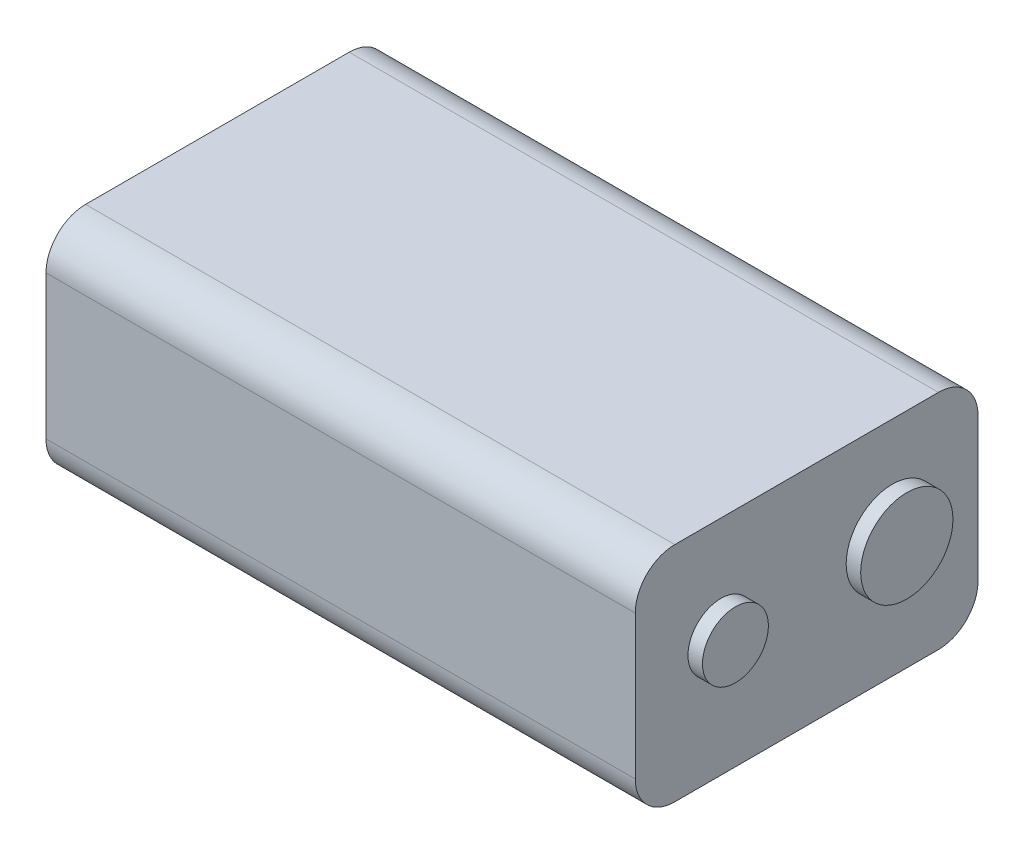
from build123d import *

# Parameters (mm, degrees)
SKETCH1_W           = 44.7
SKETCH1_H           = 26
BOSS_EXTRUDE1_DEPTH = 16.9
FILLET1_R           = 3
SKETCH2_R           = 3.5
SKETCH2_R_2         = 2.5
BOSS_EXTRUDE2_DEPTH = 1.1


with BuildPart() as part:
    # Sketch1 → Boss-Extrude1 (new body)
    with BuildSketch(Plane(origin=(0, 0, 0), x_dir=(1, 0, 0), z_dir=(0, 1, 0))):
        with Locations((0.402556883, 5.297981579)):
            Rectangle(SKETCH1_W, SKETCH1_H)
    extrude(amount=BOSS_EXTRUDE1_DEPTH)

    # Fillet1
    fillet1_edges = [part.edges().sort_by_distance(p)[0] for p in [
        (0.402556883, 16.9, -18.297981579),
        (0.402556883, 0, -18.297981579),
        (0.402556883, 0, 7.702018421),
        (0.402556883, 16.9, 7.702018421),
    ]]
    fillet(fillet1_edges, radius=FILLET1_R)

    # Sketch2 → Boss-Extrude2 (add)
    with BuildSketch(Plane(origin=(22.752556883, 0, 0), x_dir=(0, 0, -1), z_dir=(1, 0, 0))):
        with Locations((11.797981579, 9.11818414)):
            Circle(SKETCH2_R)
        with Locations((-1.202018421, 9.11818414)):
            Circle(SKETCH2_R_2)
    extrude(amount=BOSS_EXTRUDE2_DEPTH)


solid = part.part
